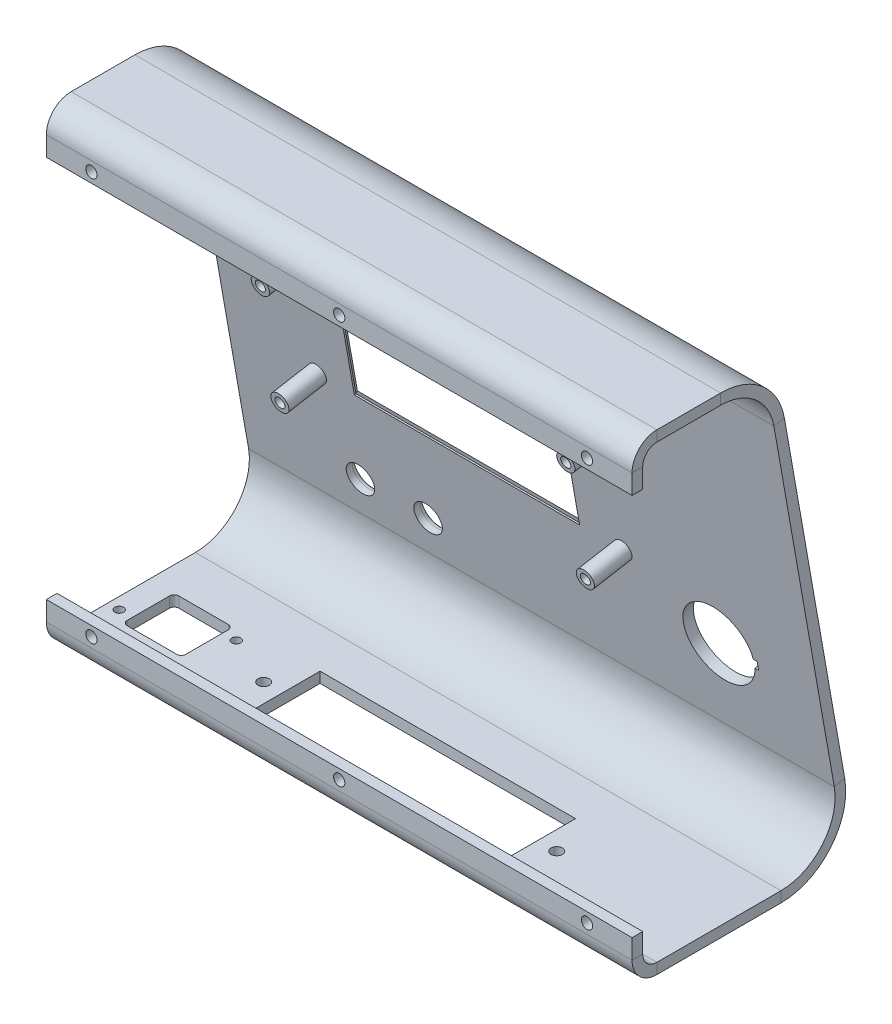
from build123d import *

# Parameters (mm, degrees)
BASE_FLANGE1_DEPTH   = 165.1
SKETCH6_W            = 63.5
SKETCH6_H            = 38.1
CUT_EXTRUDE1_DEPTH   = 218.169427211
CHAMFER1_SIZE        = 2.54
SKETCH8_R            = 2.54
BOSS_EXTRUDE1_DEPTH  = 10.7315
LPATTERN1_COUNT      = 2
LPATTERN1_PITCH      = 31.75
LPATTERN1_COUNT_DIR2 = 2
LPATTERN1_PITCH_DIR2 = 86.106
SKETCH9_R            = 3.969000063
CUT_EXTRUDE2_DEPTH   = 218.169427211
LPATTERN2_COUNT      = 2
LPATTERN2_PITCH      = 19.05
CUT_EXTRUDE3_DEPTH   = 218.169427211
CUT_EXTRUDE5_REACH   = 228.091
SKETCH11_R           = 1.5875
SKETCH11_W           = 72
SKETCH11_H           = 21.2
SKETCH12_R           = 1.5875
CUT_EXTRUDE6_DEPTH   = 3
SKETCH13_R           = 1.234202105
SKETCH13_W           = 16.55
SKETCH13_H           = 14.55
CUT_EXTRUDE7_DEPTH   = 3
FILLET1_R            = 1.3
FILLET2_R            = 1.27
SKETCH14_R           = 1.4224
CUT_EXTRUDE8_DEPTH   = 6.35


# Sheet-metal steps are written as plain solids
with BuildPart() as part:
    # Sketch1 → Base-Flange1 (new body)
    with BuildSketch(Plane(origin=(0, 0, 0), x_dir=(0, 0, -1), z_dir=(1, 0, 0))):
        with BuildLine():
            Line((21.322905549, 20.238293522), (21.322905549, 14.71329365))
            ThreePointArc((21.322905549, 14.71329365), (22.494478461, 11.884866435), (25.322905677, 10.713293522))
            Line((25.322905677, 10.713293522), (60.310580797, 10.713293522))
            ThreePointArc((60.310580797, 10.713293522), (71.985098111, 16.15721035), (75.319050953, 28.59969175))
            Line((75.319050953, 28.59969175), (58.299970775, 125.11969175))
            ThreePointArc((58.299970775, 125.11969175), (53.087583791, 134.147810835), (43.291500619, 137.713293522))
            Line((43.291500619, 137.713293522), (25.322905677, 137.713293522))
            ThreePointArc((25.322905677, 137.713293522), (22.494478461, 136.541720609), (21.322905549, 133.713293394))
            Line((21.322905549, 133.713293394), (21.322905549, 128.188293522))
            Line((21.322905549, 128.188293522), (18.322905549, 128.188293522))
            Line((18.322905549, 128.188293522), (18.322905549, 133.713293394))
            ThreePointArc((18.322905549, 133.713293394), (20.373158118, 138.663040953), (25.322905677, 140.713293522))
            Line((25.322905677, 140.713293522), (43.291500619, 140.713293522))
            ThreePointArc((43.291500619, 140.713293522), (55.01594662, 136.445944164), (61.254394034, 125.640636283))
            Line((61.254394034, 125.640636283), (78.273474212, 29.120636283))
            ThreePointArc((78.273474212, 29.120636283), (74.28323144, 14.228847521), (60.310580797, 7.713293522))
            Line((60.310580797, 7.713293522), (25.322905677, 7.713293522))
            ThreePointArc((25.322905677, 7.713293522), (20.373158118, 9.763546091), (18.322905549, 14.71329365))
            Line((18.322905549, 14.71329365), (18.322905549, 20.238293522))
            Line((18.322905549, 20.238293522), (21.322905549, 20.238293522))
        make_face()
    extrude(amount=BASE_FLANGE1_DEPTH)

    # Sketch6 → Cut-Extrude1 (cut, through all)
    with BuildSketch(Plane(origin=(0, 14.263647062, -80.893162264), x_dir=(-1, 0, 0), z_dir=(0, 0.1736481776669347, -0.9848077530122075))):
        with Locations((-67.564, 68.645158806)):
            Rectangle(SKETCH6_W, SKETCH6_H)
    extrude(amount=-CUT_EXTRUDE1_DEPTH, mode=Mode.SUBTRACT)

    # Chamfer1
    chamfer1_edges = [part.edges().sort_by_distance(p)[0] for p in [
        (99.314, 81.865931661, -68.973055532),
        (67.564, 63.105343966, -72.281053316),
        (35.814, 81.865931661, -68.973055532),
        (67.564, 100.626519356, -65.665057747),
    ]]
    chamfer(chamfer1_edges, length=CHAMFER1_SIZE)

    # Sketch8 → Boss-Extrude1 (add)
    with BuildSketch(Plane(origin=(0, 13.742702529, -77.938739005), x_dir=(1, 0, 0), z_dir=(0, -0.1736481776669347, 0.9848077530122075))):
        with Locations(Location((25.4, 49.595158806, 0), (0, 0, 270))):
            Circle(SKETCH8_R)
    boss_extrude1 = extrude(amount=BOSS_EXTRUDE1_DEPTH)

    # LPattern1: Boss-Extrude1 2 × 2
    with Locations(*[Vector(0, 0.9848077530122074, 0.17364817766693458) * (i * LPATTERN1_PITCH) + Vector(1, 0, 0) * (j * LPATTERN1_PITCH_DIR2) for i in range(LPATTERN1_COUNT) for j in range(LPATTERN1_COUNT_DIR2) if (i, j) != (0, 0)]):
        add(boss_extrude1)

    # Sketch9 → Cut-Extrude2 (cut, through all)
    with BuildSketch(Plane(origin=(0, 14.263647062, -80.893162264), x_dir=(-1, 0, 0), z_dir=(0, 0.1736481776669347, -0.9848077530122075))):
        with Locations(Location((-52.3748, 25.312758806, 0), (0, 0, 90))):
            Circle(SKETCH9_R)
    cut_extrude2 = extrude(amount=-CUT_EXTRUDE2_DEPTH, mode=Mode.SUBTRACT)

    # LPattern2: Cut-Extrude2 ×2
    with Locations(*[(-i * LPATTERN2_PITCH, 0, 0) for i in range(1, LPATTERN2_COUNT)]):
        add(cut_extrude2, mode=Mode.SUBTRACT)

    # Sketch10 → Cut-Extrude3 (cut, through all)
    with BuildSketch(Plane(origin=(0, 14.263647062, -80.893162264), x_dir=(-1, 0, 0), z_dir=(0, 0.17364817766693483, -0.9848077530122072))):
        with BuildLine():
            Line((-147.577626964, 39.365158806), (-147.577626964, 36.965158806))
            Line((-147.577626964, 36.965158806), (-146.505365759, 36.965158806))
            ThreePointArc((-146.505365759, 36.965158806), (-126.577626964, 38.165158806), (-146.505365759, 39.365158806))
            Line((-146.505365759, 39.365158806), (-147.577626964, 39.365158806))
        make_face()
    extrude(amount=-CUT_EXTRUDE3_DEPTH, mode=Mode.SUBTRACT)

    # Sketch11 → Cut-Extrude5 (cut, up to next)
    with BuildSketch(Plane(origin=(0, 7.713293522, 0), x_dir=(-1, 0, 0), z_dir=(0, -1, 0)), mode=Mode.PRIVATE) as cut_extrude5_sk1:
        with Locations(Location((-41.25, 38.327705677, 0), (0, 0, 90))):
            Circle(SKETCH11_R)
    cut_extrude5_tool1 = extrude(cut_extrude5_sk1.sketch, amount=-CUT_EXTRUDE5_REACH, mode=Mode.PRIVATE) & part.part
    # Sketch11 → Cut-Extrude5 (cut, up to next)
    with BuildSketch(Plane(origin=(0, 7.713293522, 0), x_dir=(-1, 0, 0), z_dir=(0, -1, 0)), mode=Mode.PRIVATE) as cut_extrude5_sk2:
        with Locations(Location((-123.85, 38.327705677, 0), (0, 0, 90))):
            Circle(SKETCH11_R)
    cut_extrude5_tool2 = extrude(cut_extrude5_sk2.sketch, amount=-CUT_EXTRUDE5_REACH, mode=Mode.PRIVATE) & part.part
    # Sketch11 → Cut-Extrude5 (cut, up to next)
    with BuildSketch(Plane(origin=(0, 7.713293522, 0), x_dir=(-1, 0, 0), z_dir=(0, -1, 0)), mode=Mode.PRIVATE) as cut_extrude5_sk3:
        with Locations((-82.55, 38.327705677)):
            Rectangle(SKETCH11_W, SKETCH11_H)
    cut_extrude5_tool3 = extrude(cut_extrude5_sk3.sketch, amount=-CUT_EXTRUDE5_REACH, mode=Mode.PRIVATE) & part.part
    add(cut_extrude5_tool1.solids().sort_by_distance((41.25, 7.713294, -38.327706))[0], mode=Mode.SUBTRACT)
    add(cut_extrude5_tool2.solids().sort_by_distance((123.85, 7.713294, -38.327706))[0], mode=Mode.SUBTRACT)
    add(cut_extrude5_tool3.solids().sort_by_distance((82.55, 7.713294, -38.327706))[0], mode=Mode.SUBTRACT)

    # Sketch12 → Cut-Extrude6 (cut)
    with BuildSketch(Plane.XY.offset(-18.322905549)):
        with Locations((152.4, 130.950793458)):
            Circle(SKETCH12_R)
        with Locations((152.4, 17.475793586)):
            Circle(SKETCH12_R)
        with Locations((82.55, 17.475793586)):
            Circle(SKETCH12_R)
        with Locations((82.55, 130.950793458)):
            Circle(SKETCH12_R)
        with Locations((12.7, 130.950793458)):
            Circle(SKETCH12_R)
        with Locations((12.7, 17.475793586)):
            Circle(SKETCH12_R)
    extrude(amount=-CUT_EXTRUDE6_DEPTH, mode=Mode.SUBTRACT)

    # Sketch13 → Cut-Extrude7 (cut)
    with BuildSketch(Plane(origin=(0, 7.713293522, 0), x_dir=(-1, 0, 0), z_dir=(0, -1, 0))):
        with Locations(Location((-3.24, 35.61403221, 0), (0, 0, 90))):
            Circle(SKETCH13_R)
        with Locations(Location((-27.24, 44.61403221, 0), (0, 0, 90))):
            Circle(SKETCH13_R)
        with Locations((-15.24, 40.11403221)):
            Rectangle(SKETCH13_W, SKETCH13_H)
    extrude(amount=-CUT_EXTRUDE7_DEPTH, mode=Mode.SUBTRACT)

    # Fillet1
    fillet1_edges = [part.edges().sort_by_distance(p)[0] for p in [
        (6.965, 9.213293522, -47.38903221),
        (6.965, 9.213293522, -32.83903221),
        (23.515, 9.213293522, -32.83903221),
        (23.515, 9.213293522, -47.38903221),
    ]]
    fillet(fillet1_edges, radius=FILLET1_R)

    # Fillet2
    fillet2_edges = [part.edges().sort_by_distance(p)[0] for p in [
        (52.3748, 35.283146151, -77.186857454),
        (33.3248, 35.283146151, -77.186857454),
    ]]
    fillet(fillet2_edges, radius=FILLET2_R)

    # Sketch14 → Cut-Extrude8 (cut)
    with BuildSketch(Plane(origin=(0, 11.87919711, -67.370274604), x_dir=(1, 0, 0), z_dir=(0, -0.17364817766693477, 0.9848077530122074))):
        with Locations(Location((111.506, 81.345158806, 0), (0, 0, 270))):
            Circle(SKETCH14_R)
        with Locations(Location((111.506, 49.595158806, 0), (0, 0, 270))):
            Circle(SKETCH14_R)
        with Locations(Location((25.4, 49.595158806, 0), (0, 0, 270))):
            Circle(SKETCH14_R)
        with Locations(Location((25.4, 81.345158806, 0), (0, 0, 270))):
            Circle(SKETCH14_R)
    extrude(amount=-CUT_EXTRUDE8_DEPTH, mode=Mode.SUBTRACT)


solid = part.part
